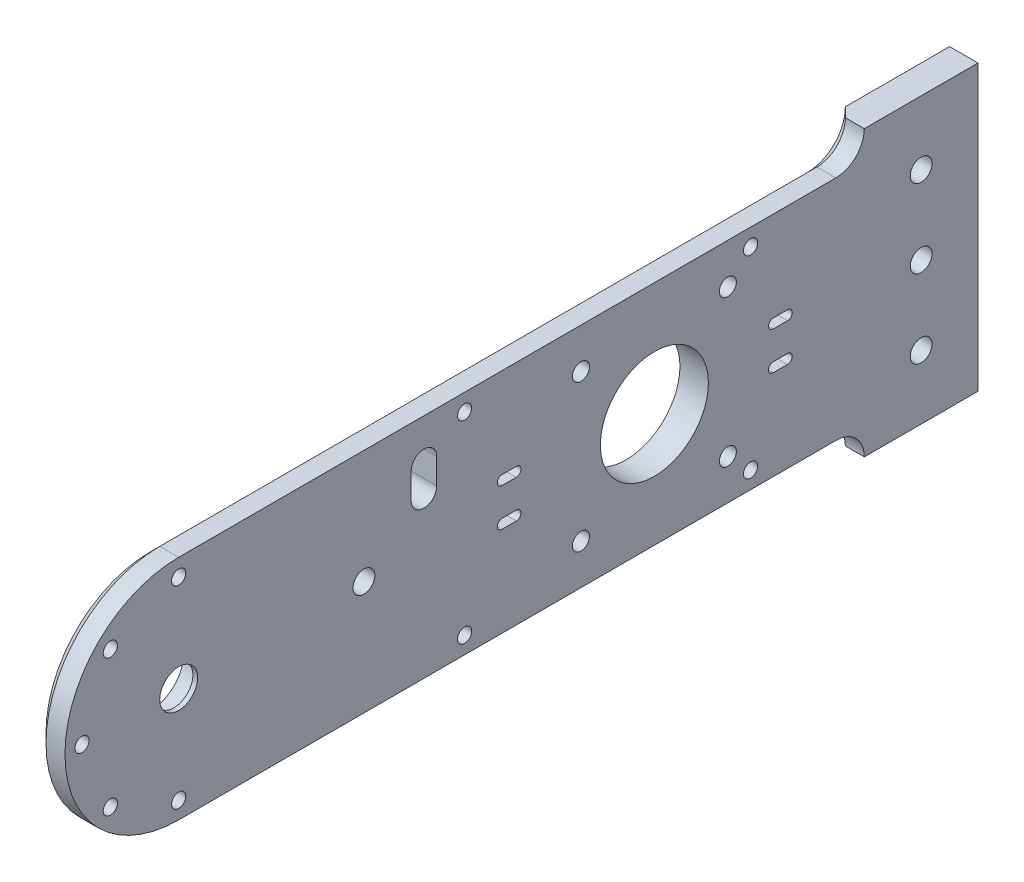
from build123d import *

# Parameters (mm, degrees)
SKETCH1_R              = 11.4
SKETCH1_R_2            = 1.8
SKETCH1_R_3            = 2.3
SKETCH1_R_4            = 4
BOSS_EXTRUDE1_DEPTH    = 7
CHAMFER2_SIZE          = 2
CUT_EXTRUDE2_DEPTH     = 196.146842147
SKETCH4_R              = 1.5
CUT_EXTRUDE3_DEPTH     = 196.146842147
SKETCH6_R              = 7.1
CUT_EXTRUDE4_DEPTH     = 5
SKETCH7_R              = 2.3
CUT_EXTRUDE5_DEPTH     = 10
CUT_EXTRUDE6_DEPTH     = 10
MOVE_START             = 6
MOVE_FACE2_OUTLINE_R   = 2.3
MOVE_FACE2_OUTLINE_R_2 = 1.5
MOVE_FACE2_OUTLINE_R_3 = 1.8
MOVE_FACE2_OUTLINE_R_4 = 11.4
MOVE_FACE2_OUTLINE_R_5 = 4
MOVE_FACE2_DEPTH       = 1


# Read off the part's stored shape, not the designer's step: Move Face2
with BuildPart() as part:
    # Sketch1 → Boss-Extrude1 (new body)
    with BuildSketch(Plane(origin=(0, 0, 0), x_dir=(0, 0, -1), z_dir=(1, 0, 0))):
        with BuildLine():
            Line((-168.7, 24), (-30, 24))
            ThreePointArc((-30, 24), (-25.757359313, 25.757359313), (-24, 30))
            Line((-24, 30), (-12, 30))
            Line((-12, 30), (0, 30))
            Line((0, 30), (0, 24))
            Line((0, 24), (0, 0))
            Line((0, 0), (0, -24))
            Line((0, -24), (0, -30))
            Line((0, -30), (-12, -30))
            Line((-12, -30), (-24, -30))
            ThreePointArc((-24, -30), (-25.757359313, -25.757359313), (-30, -24))
            Line((-30, -24), (-168.7, -24))
            ThreePointArc((-168.7, -24), (-192.7, 0), (-168.7, 24))
        make_face()
        with Locations((-68.3, 0)):
            Circle(SKETCH1_R, mode=Mode.SUBTRACT)
        with Locations((-83.8, 15.5)):
            Circle(SKETCH1_R_2, mode=Mode.SUBTRACT)
        with Locations((-52.8, 15.5)):
            Circle(SKETCH1_R_2, mode=Mode.SUBTRACT)
        with Locations((-83.8, -15.5)):
            Circle(SKETCH1_R_2, mode=Mode.SUBTRACT)
        with Locations((-52.8, -15.5)):
            Circle(SKETCH1_R_2, mode=Mode.SUBTRACT)
        with Locations((-12, 16.5)):
            Circle(SKETCH1_R_3, mode=Mode.SUBTRACT)
        with Locations((-12, 0)):
            Circle(SKETCH1_R_3, mode=Mode.SUBTRACT)
        with Locations((-12, -16.5)):
            Circle(SKETCH1_R_3, mode=Mode.SUBTRACT)
        with Locations((-168.7, 0)):
            Circle(SKETCH1_R_4, mode=Mode.SUBTRACT)
    extrude(amount=BOSS_EXTRUDE1_DEPTH)

    # Chamfer2
    chamfer2_edges = [part.edges().sort_by_distance(p)[0] for p in [
        (0, -25.757359313, 25.757359313),
        (0, -24, 99.35),
        (0, 0, 192.7),
        (0, 24, 99.35),
        (0, 25.757359313, 25.757359313),
    ]]
    chamfer(chamfer2_edges, length=CHAMFER2_SIZE)

    # Sketch3 → Cut-Extrude2 (cut, through all)
    with BuildSketch(Plane(origin=(7, 0, 0), x_dir=(0, 0, -1), z_dir=(1, 0, 0))):
        with BuildLine():
            Line((-114.233163347, 15.207239819), (-114.233163347, 9.807239819))
            ThreePointArc((-114.233163347, 9.807239819), (-116.933163347, 7.107239819), (-119.633163347, 9.807239819))
            Line((-119.633163347, 9.807239819), (-119.633163347, 15.207239819))
            ThreePointArc((-119.633163347, 15.207239819), (-116.933163347, 17.907239819), (-114.233163347, 15.207239819))
        make_face()
    extrude(amount=-CUT_EXTRUDE2_DEPTH, mode=Mode.SUBTRACT)

    # Sketch4 → Cut-Extrude3 (cut, through all)
    with BuildSketch(Plane.ZY):
        with Locations((108.35, -20.4)):
            Circle(SKETCH4_R)
        with Locations((168.7, -20.4)):
            Circle(SKETCH4_R)
        with Locations((168.7, 20.4)):
            Circle(SKETCH4_R)
        with Locations((183.124978336, 14.424978336)):
            Circle(SKETCH4_R)
        with Locations((189.1, 0)):
            Circle(SKETCH4_R)
        with Locations((183.124978336, -14.424978336)):
            Circle(SKETCH4_R)
        with Locations((108.35, 20.4)):
            Circle(SKETCH4_R)
        with Locations((48, -20.4)):
            Circle(SKETCH4_R)
        with Locations((48, 20.4)):
            Circle(SKETCH4_R)
    extrude(amount=-CUT_EXTRUDE3_DEPTH, mode=Mode.SUBTRACT)

    # Sketch6 → Cut-Extrude4 (cut)
    with BuildSketch(Plane.ZY):
        with Locations((168.7, 0)):
            Circle(SKETCH6_R)
    extrude(amount=-CUT_EXTRUDE4_DEPTH, mode=Mode.SUBTRACT)

    # Sketch7 → Cut-Extrude5 (cut)
    with BuildSketch(Plane(origin=(7, 0, 0), x_dir=(0, 0, -1), z_dir=(1, 0, 0))):
        with Locations((-129.6, 0)):
            Circle(SKETCH7_R)
    extrude(amount=-CUT_EXTRUDE5_DEPTH, mode=Mode.SUBTRACT)

    # Sketch8 → Cut-Extrude6 (cut)
    with BuildSketch(Plane(origin=(7, 0, 0), x_dir=(0, 0, -1), z_dir=(1, 0, 0))):
        with BuildLine():
            Line((-97.45, -5), (-100.45, -5))
            ThreePointArc((-100.45, -5), (-101.45, -4), (-100.45, -3))
            Line((-100.45, -3), (-97.45, -3))
            ThreePointArc((-97.45, -3), (-96.45, -4), (-97.45, -5))
        make_face()
        with BuildLine():
            Line((-97.45, 5), (-100.45, 5))
            ThreePointArc((-100.45, 5), (-101.45, 4), (-100.45, 3))
            Line((-100.45, 3), (-97.45, 3))
            ThreePointArc((-97.45, 3), (-96.45, 4), (-97.45, 5))
        make_face()
        with BuildLine():
            Line((-40.2, -5), (-43.2, -5))
            ThreePointArc((-43.2, -5), (-44.2, -4), (-43.2, -3))
            Line((-43.2, -3), (-40.2, -3))
            ThreePointArc((-40.2, -3), (-39.2, -4), (-40.2, -5))
        make_face()
        with BuildLine():
            Line((-40.2, 5), (-43.2, 5))
            ThreePointArc((-43.2, 5), (-44.2, 4), (-43.2, 3))
            Line((-43.2, 3), (-40.2, 3))
            ThreePointArc((-40.2, 3), (-39.2, 4), (-40.2, 5))
        make_face()
    extrude(amount=-CUT_EXTRUDE6_DEPTH, mode=Mode.SUBTRACT)

    # Move Face2 outline → Move Face2 (cut)
    with BuildSketch(Plane.YZ.offset(MOVE_START)):
        with BuildLine():
            Line((-30, 24), (-30, 0))
            Line((-30, 0), (30, 0))
            Line((30, 0), (30, 24))
            ThreePointArc((30, 24), (25.757359313, 25.757359313), (24, 30))
            Line((24, 30), (24, 168.7))
            ThreePointArc((24, 168.7), (0, 192.7), (-24, 168.7))
            Line((-24, 168.7), (-24, 30))
            ThreePointArc((-24, 30), (-25.757359313, 25.757359313), (-30, 24))
        make_face()
        with Locations((-16.5, 12)):
            Circle(MOVE_FACE2_OUTLINE_R, mode=Mode.SUBTRACT)
        with Locations((-20.4, 48)):
            Circle(MOVE_FACE2_OUTLINE_R_2, mode=Mode.SUBTRACT)
        with BuildLine():
            Line((-5, 40.2), (-5, 43.2))
            ThreePointArc((-5, 43.2), (-4, 44.2), (-3, 43.2))
            Line((-3, 43.2), (-3, 40.2))
            ThreePointArc((-3, 40.2), (-4, 39.2), (-5, 40.2))
        make_face(mode=Mode.SUBTRACT)
        with Locations((-15.5, 52.8)):
            Circle(MOVE_FACE2_OUTLINE_R_3, mode=Mode.SUBTRACT)
        with Locations((-15.5, 83.8)):
            Circle(MOVE_FACE2_OUTLINE_R_3, mode=Mode.SUBTRACT)
        with Locations((0, 12)):
            Circle(MOVE_FACE2_OUTLINE_R, mode=Mode.SUBTRACT)
        with BuildLine():
            ThreePointArc((5, 40.2), (4, 39.2), (3, 40.2))
            Line((3, 40.2), (3, 43.2))
            ThreePointArc((3, 43.2), (4, 44.2), (5, 43.2))
            Line((5, 43.2), (5, 40.2))
        make_face(mode=Mode.SUBTRACT)
        with Locations((16.5, 12)):
            Circle(MOVE_FACE2_OUTLINE_R, mode=Mode.SUBTRACT)
        with Locations((20.4, 48)):
            Circle(MOVE_FACE2_OUTLINE_R_2, mode=Mode.SUBTRACT)
        with Locations((0, 68.3)):
            Circle(MOVE_FACE2_OUTLINE_R_4, mode=Mode.SUBTRACT)
        with Locations((15.5, 52.8)):
            Circle(MOVE_FACE2_OUTLINE_R_3, mode=Mode.SUBTRACT)
        with Locations((15.5, 83.8)):
            Circle(MOVE_FACE2_OUTLINE_R_3, mode=Mode.SUBTRACT)
        with Locations((-20.4, 108.35)):
            Circle(MOVE_FACE2_OUTLINE_R_2, mode=Mode.SUBTRACT)
        with BuildLine():
            ThreePointArc((-3, 97.45), (-4, 96.45), (-5, 97.45))
            Line((-5, 97.45), (-5, 100.45))
            ThreePointArc((-5, 100.45), (-4, 101.45), (-3, 100.45))
            Line((-3, 100.45), (-3, 97.45))
        make_face(mode=Mode.SUBTRACT)
        with Locations((-20.4, 168.7)):
            Circle(MOVE_FACE2_OUTLINE_R_2, mode=Mode.SUBTRACT)
        with Locations((-14.424978336, 183.124978336)):
            Circle(MOVE_FACE2_OUTLINE_R_2, mode=Mode.SUBTRACT)
        with BuildLine():
            Line((3, 97.45), (3, 100.45))
            ThreePointArc((3, 100.45), (4, 101.45), (5, 100.45))
            Line((5, 100.45), (5, 97.45))
            ThreePointArc((5, 97.45), (4, 96.45), (3, 97.45))
        make_face(mode=Mode.SUBTRACT)
        with BuildLine():
            ThreePointArc((15.207239819, 119.633163347), (17.907239819, 116.933163347), (15.207239819, 114.233163347))
            Line((15.207239819, 114.233163347), (9.807239819, 114.233163347))
            ThreePointArc((9.807239819, 114.233163347), (7.107239819, 116.933163347), (9.807239819, 119.633163347))
            Line((9.807239819, 119.633163347), (15.207239819, 119.633163347))
        make_face(mode=Mode.SUBTRACT)
        with Locations((0, 129.6)):
            Circle(MOVE_FACE2_OUTLINE_R, mode=Mode.SUBTRACT)
        with Locations((20.4, 108.35)):
            Circle(MOVE_FACE2_OUTLINE_R_2, mode=Mode.SUBTRACT)
        with Locations((0, 168.7)):
            Circle(MOVE_FACE2_OUTLINE_R_5, mode=Mode.SUBTRACT)
        with Locations((0, 189.1)):
            Circle(MOVE_FACE2_OUTLINE_R_2, mode=Mode.SUBTRACT)
        with Locations((14.424978336, 183.124978336)):
            Circle(MOVE_FACE2_OUTLINE_R_2, mode=Mode.SUBTRACT)
        with Locations((20.4, 168.7)):
            Circle(MOVE_FACE2_OUTLINE_R_2, mode=Mode.SUBTRACT)
    extrude(amount=MOVE_FACE2_DEPTH, mode=Mode.SUBTRACT)


solid = part.part
